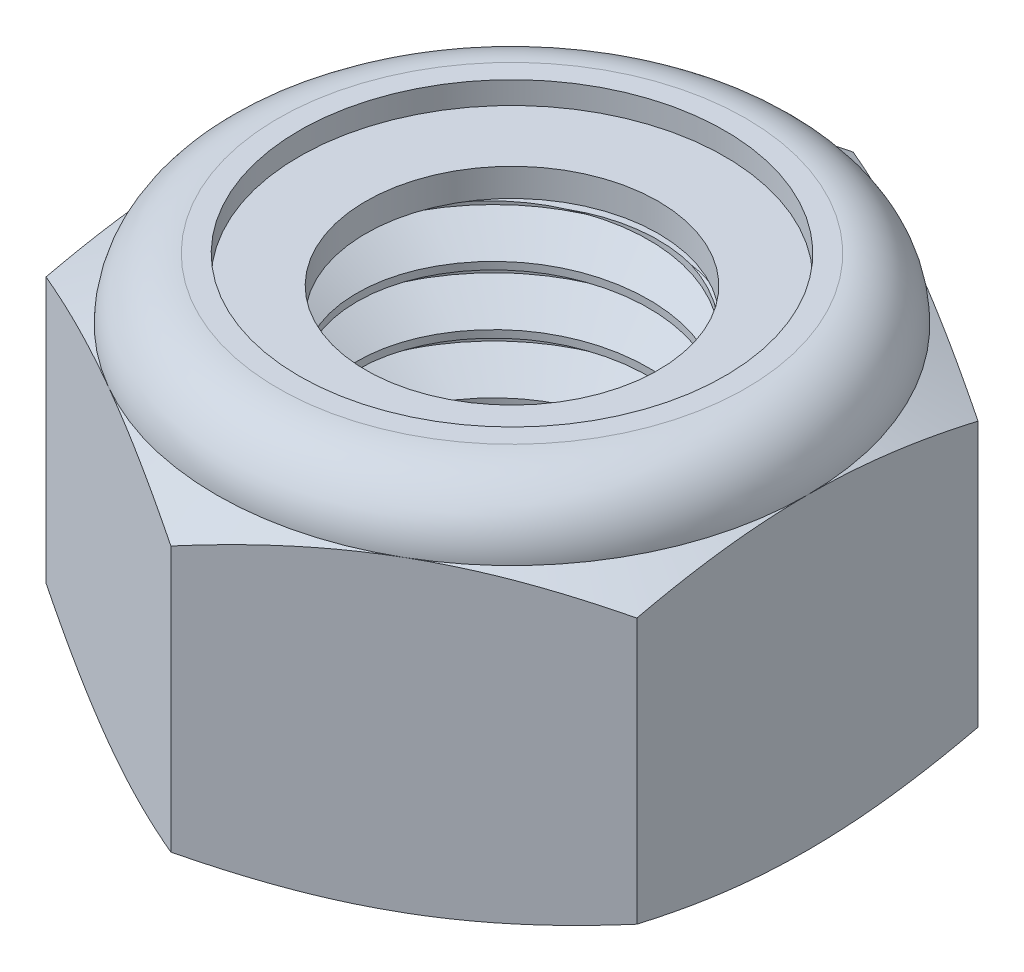
from build123d import *

# Parameters (mm, degrees)
SKETCH1_R      = 2.5
EXTRUDE1_DEPTH = 5
SWEEP1_PITCH   = 0.8
SPLIT1_START   = 5
SPLIT1_DEPTH   = 0.725
SPLIT2_START   = -0.8250001
SPLIT2_DEPTH   = 0.8250001


# Read off the part's stored shape, not the designer's step: Split1, Split2
with BuildPart() as part:
    # Sketch1 → Extrude1 (new body)
    with BuildSketch(Plane(origin=(0, 0, 0), x_dir=(1, 0, 0), z_dir=(0, 1, 0))):
        Polygon((0, 4.618802154), (-4, 2.309401077), (-4, -2.309401077), (0, -4.618802154), (4, -2.309401077), (4, 2.309401077), align=None)
        with Locations(Location((0, 0, 0), (0, 0, 270))):
            Circle(SKETCH1_R, mode=Mode.SUBTRACT)
    extrude(amount=EXTRUDE1_DEPTH)

    # Sweep1: the profile of Sketch9 screwed along a right-hand helix of 7.25 turns, 8 arcs to a turn; built about Z, then put on its axis
    sweep1_z = Axis((0, 0, 0), (0, 0, 1))
    sweep1_corners = [(2.54330127, 0, 0.025), (2.54330127, 0, -0.725), (1.980384758, 0, -0.4), (1.980384758, 0, -0.3)]
    with BuildLine(mode=Mode.PRIVATE) as sweep1_profile:
        Line(sweep1_corners[0], sweep1_corners[1])
        Line(sweep1_corners[1], sweep1_corners[2])
        Line(sweep1_corners[2], sweep1_corners[3])
        Line(sweep1_corners[3], sweep1_corners[0])
    sweep1_cap = Face(sweep1_profile.wire())
    sweep1_turn_angles = [0, 22.5, 45, 67.5, 90, 112.5, 135, 157.5, 180, 202.5, 225, 247.5, 270, 292.5, 315, 337.5, 360]
    sweep1_turn_weights = [1, 0.9238795325112867, 1, 0.9238795325112867, 1, 0.9238795325112867, 1, 0.9238795325112867, 1, 0.9238795325112867, 1, 0.9238795325112867, 1, 0.9238795325112867, 1, 0.9238795325112867, 1]
    sweep1_turn_rails = [Edge.make_bspline([Vector(p[0], p[1], 0).rotate(sweep1_z, sweep1_turn_angles[k]) / sweep1_turn_weights[k] + Vector(0, 0, p[2] + SWEEP1_PITCH * sweep1_turn_angles[k] / 360) for k in range(17)], [0, 0, 0, 1, 1, 2, 2, 3, 3, 4, 4, 5, 5, 6, 6, 7, 7, 8, 8, 8], 2, sweep1_turn_weights) for p in sweep1_corners]
    sweep1_turn_sides = [Face.make_surface_from_curves(sweep1_turn_rails[p[0]], sweep1_turn_rails[p[1]]) for p in [(0, 1), (1, 2), (2, 3), (3, 0)]]
    sweep1_last_angles = [2520, 2542.5, 2565, 2587.5, 2610]
    sweep1_last_weights = [1, 0.9238795325112867, 1, 0.923879532511299, 1]
    sweep1_last_rails = [Edge.make_bspline([Vector(p[0], p[1], 0).rotate(sweep1_z, sweep1_last_angles[k]) / sweep1_last_weights[k] + Vector(0, 0, p[2] + SWEEP1_PITCH * sweep1_last_angles[k] / 360) for k in range(5)], [0, 0, 0, 1, 1, 2, 2, 2], 2, sweep1_last_weights) for p in sweep1_corners]
    sweep1_last_sides = [Face.make_surface_from_curves(sweep1_last_rails[p[0]], sweep1_last_rails[p[1]]) for p in [(0, 1), (1, 2), (2, 3), (3, 0)]]
    sweep1 = Plane(origin=(0, 5, 0), x_dir=(0, 0, 1), z_dir=(0, -1, 0)) * Solid(Shell([*[p.moved(Location((0, 0, SWEEP1_PITCH * i))) for i in range(7) for p in sweep1_turn_sides], *sweep1_last_sides, sweep1_cap, sweep1_cap.rotate(sweep1_z, 2610).moved(Location((0, 0, SWEEP1_PITCH * 2610 / 360)))]))
    add(sweep1)

    # Split1 outline → Split1 (cut)
    # profile 1 of 2: a face of its own
    with BuildSketch(Plane(origin=(0, 0, 0), x_dir=(1, 0, 0), z_dir=(0, 1, 0)).offset(SPLIT1_START)):
        Polygon((4, 4), (0, 4), (-4, 4), (-4, -4), (4, -4), align=None)
        with BuildLine():
            Line((0, -1.980384758), (0, -2.54330127))
            add(Edge.make_bspline(
                [(0, -2.54330127), (-1.053469879, -2.54330127), (-1.798385575, -1.798385575), (-2.54330127, -1.053469879), (-2.54330127, 0), (-2.54330127, 1.053469879), (-1.798385575, 1.798385575), (-1.053469879, 2.54330127), (0, 2.54330127)],
                knots=[0, 0, 0, 0.015625, 0.015625, 0.03125, 0.03125, 0.046875, 0.046875, 0.0625, 0.0625, 0.0625], degree=2, weights=[1, 0.923879533, 1, 0.923879533, 1, 0.923879533, 1, 0.923879533, 1]))
            Line((0, 2.54330127), (0, -1.980384758))
        make_face(mode=Mode.SUBTRACT)
    # profile 2 of 2: a face of its own
    with BuildSketch(Plane(origin=(0, 0, 0), x_dir=(1, 0, 0), z_dir=(0, 1, 0)).offset(SPLIT1_START)):
        with BuildLine():
            add(Edge.make_bspline(
                [(0, -2.54330127), (-1.053469879, -2.54330127), (-1.798385575, -1.798385575), (-2.54330127, -1.053469879), (-2.54330127, 0), (-2.54330127, 1.053469879), (-1.798385575, 1.798385575), (-1.053469879, 2.54330127), (0, 2.54330127)],
                knots=[0, 0, 0, 0.015625, 0.015625, 0.03125, 0.03125, 0.046875, 0.046875, 0.0625, 0.0625, 0.0625], degree=2, weights=[1, 0.923879533, 1, 0.923879533, 1, 0.923879533, 1, 0.923879533, 1]))
            Line((0, -2.54330127), (0, -1.980384758))
            Line((0, -1.980384758), (0, 2.54330127))
        make_face()
    extrude(amount=SPLIT1_DEPTH, mode=Mode.SUBTRACT)

    # Cut-Extrude1 cone 1 section (through the dimple's axis) → Cut-Extrude1 (revolve, cut)
    with BuildSketch(Plane(origin=(0, 5, 0), x_dir=(0, 0, 1), z_dir=(1, 0, 0))):
        Polygon((0, 0), (2.5, 0), (0, 2.5), align=None)
    revolve(axis=Axis((0, 5, 0), (0, -1, 0)), mode=Mode.SUBTRACT)

    # Split2 outline → Split2 (cut)
    with BuildSketch(Plane(origin=(0, 0, 0), x_dir=(1, 0, 0), z_dir=(0, 1, 0)).offset(SPLIT2_START)):
        Polygon((-4, -4), (4, -4), (4, 0), (4, 4), (-4, 4), align=None)
    extrude(amount=SPLIT2_DEPTH, mode=Mode.SUBTRACT)

    # Sketch5 → Cut-Revolve3 (revolve, cut)
    with BuildSketch(Plane(origin=(0, 0, 0), x_dir=(0, 0, -1), z_dir=(1, 0, 0))):
        with BuildLine():
            Line((0, 0), (4, 0))
            Line((4, 0), (4.618802154, 0.288552183))
            Line((4.618802154, 0.288552183), (4.618802154, 3.878114484))
            Line((4.618802154, 3.878114484), (4, 4.166666667))
            ThreePointArc((4, 4.166666667), (3.755922318, 4.755922318), (3.166666667, 5))
            Line((3.166666667, 5), (3.166666667, 6.27))
            Line((3.166666667, 6.27), (5.888802154, 6.27))
            Line((5.888802154, 6.27), (5.888802154, -1.27))
            Line((5.888802154, -1.27), (0, -1.27))
            Line((0, -1.27), (0, 0))
        make_face()
    revolve(axis=Axis((0, 0, 0), (0, 1, 0)), mode=Mode.SUBTRACT)

    # Sketch6 → Cut-Revolve5 (revolve, cut)
    with BuildSketch(Plane(origin=(0, 0, 0), x_dir=(0, 0, -1), z_dir=(1, 0, 0)), mode=Mode.PRIVATE) as cut_revolve5_sk:
        with BuildLine():
            Line((0, 4.166666667), (3.696969697, 4.166666667))
            ThreePointArc((3.696969697, 4.166666667), (3.541647535, 4.541647535), (3.166666667, 4.696969697))
            Line((3.166666667, 4.696969697), (2.880184332, 4.696969697))
            Line((2.880184332, 4.696969697), (2.880184332, 6.27))
            Line((2.880184332, 6.27), (0, 6.27))
            Line((0, 6.27), (0, 4.166666667))
        make_face()
    revolve(cut_revolve5_sk.sketch.rotate(Axis((0, 6.27, 0), (0, -1, 0)), 180), axis=Axis((0, 6.27, 0), (0, -1, 0)), mode=Mode.SUBTRACT)

    # Sketch4 → Cut-Revolve4 (revolve, cut)
    with BuildSketch(Plane(origin=(0, 0, 0), x_dir=(0, 0, -1), z_dir=(1, 0, 0))):
        Polygon((0, 5), (2.5, 5), (1, 4.300538513), (1, 0.699461487), (2.5, 0), (0, 0), align=None)
    revolve(axis=Axis((0, 5, 0), (0, 1, 0)), mode=Mode.SUBTRACT)


with BuildPart() as body_2:
    # Sketch7 → Revolve2 (revolve)
    with BuildSketch(Plane(origin=(0, 0, 0), x_dir=(0, 0, -1), z_dir=(1, 0, 0))):
        with BuildLine():
            Line((1.980384758, 4.242866667), (3.61433074, 4.242866667))
            ThreePointArc((3.61433074, 4.242866667), (3.459588936, 4.513662497), (3.166666667, 4.620769697))
            Line((3.166666667, 4.620769697), (1.980384758, 4.620769697))
            Line((1.980384758, 4.620769697), (1.980384758, 4.242866667))
        make_face()
    revolve(axis=Axis((0, 4.242866667, 0), (0, 1, 0)))


solid = Compound([part.part, body_2.part])
